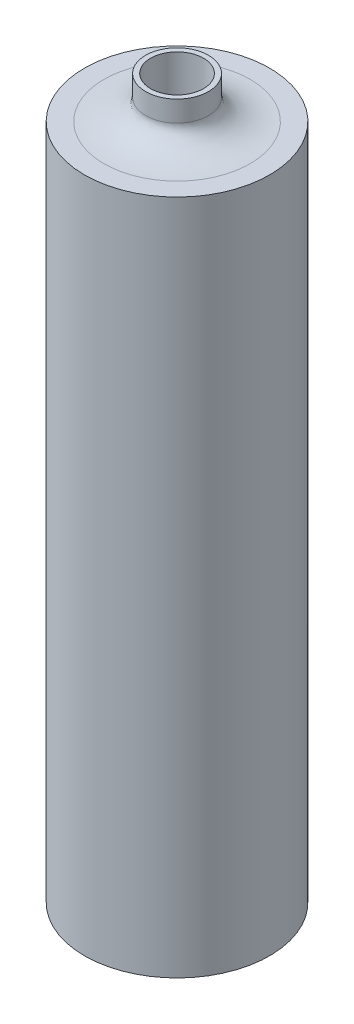
from build123d import *

# Parameters (mm, degrees)
SKETCH1_R           = 22.225
SKETCH1_R_2         = 19.05
BOSS_EXTRUDE1_DEPTH = 160
BOSS_EXTRUDE2_START = -160
SKETCH3_R           = 22.225
SKETCH3_R_2         = 6.35
BOSS_EXTRUDE2_DEPTH = 2.4
SKETCH4_R           = 7.55
SKETCH4_R_2         = 6.35
BOSS_EXTRUDE3_DEPTH = 10
FILLET1_SIZE        = 10
FILLET1_SIZE_2      = 5


with BuildPart() as part:
    # Sketch1 → Boss-Extrude1 (new body)
    with BuildSketch(Plane(origin=(0, 0, 0), x_dir=(1, 0, 0), z_dir=(0, 1, 0))):
        with Locations(Location((0, 0, 0), (0, 0, 270))):
            Circle(SKETCH1_R)
        with Locations(Location((0, 0, 0), (0, 0, 270))):
            Circle(SKETCH1_R_2, mode=Mode.SUBTRACT)
    extrude(amount=BOSS_EXTRUDE1_DEPTH)

    # Sketch3 → Boss-Extrude2 (add)
    with BuildSketch(Plane.XZ.offset(BOSS_EXTRUDE2_START)):
        with Locations(Location((0, 0, 0), (0, 0, 90))):
            Circle(SKETCH3_R)
        with Locations(Location((0, 0, 0), (0, 0, 90))):
            Circle(SKETCH3_R_2, mode=Mode.SUBTRACT)
    extrude(amount=-BOSS_EXTRUDE2_DEPTH)

    # Sketch4 → Boss-Extrude3 (add)
    with BuildSketch(Plane(origin=(0, 162.4, 0), x_dir=(-1, 0, 0), z_dir=(0, 1, 0))):
        with Locations(Location((0, 0, 0), (0, 0, 90))):
            Circle(SKETCH4_R)
        with Locations(Location((0, 0, 0), (0, 0, 90))):
            Circle(SKETCH4_R_2, mode=Mode.SUBTRACT)
    extrude(amount=BOSS_EXTRUDE3_DEPTH)

    # Fillet1
    # an asymmetric fillet: 10, 5 mm, written as the material it adds along each edge
    with BuildSketch(Plane(origin=(0, 162.4, 0), x_dir=(0, 0, 1), z_dir=(-1, 0, 0))) as fillet1_piece_1:
        with BuildLine():
            Bezier((7.55 + FILLET1_SIZE, 0), (7.55, 0), (7.55, FILLET1_SIZE_2), weights=[1, 0.707106781, 1])
            Line((7.55, FILLET1_SIZE_2), (7.55, 0))
            Line((7.55, 0), (7.55 + FILLET1_SIZE, 0))
        make_face()
    revolve(axis=Axis((0, 162.4, 0), (0, 1, 0)))


solid = part.part
